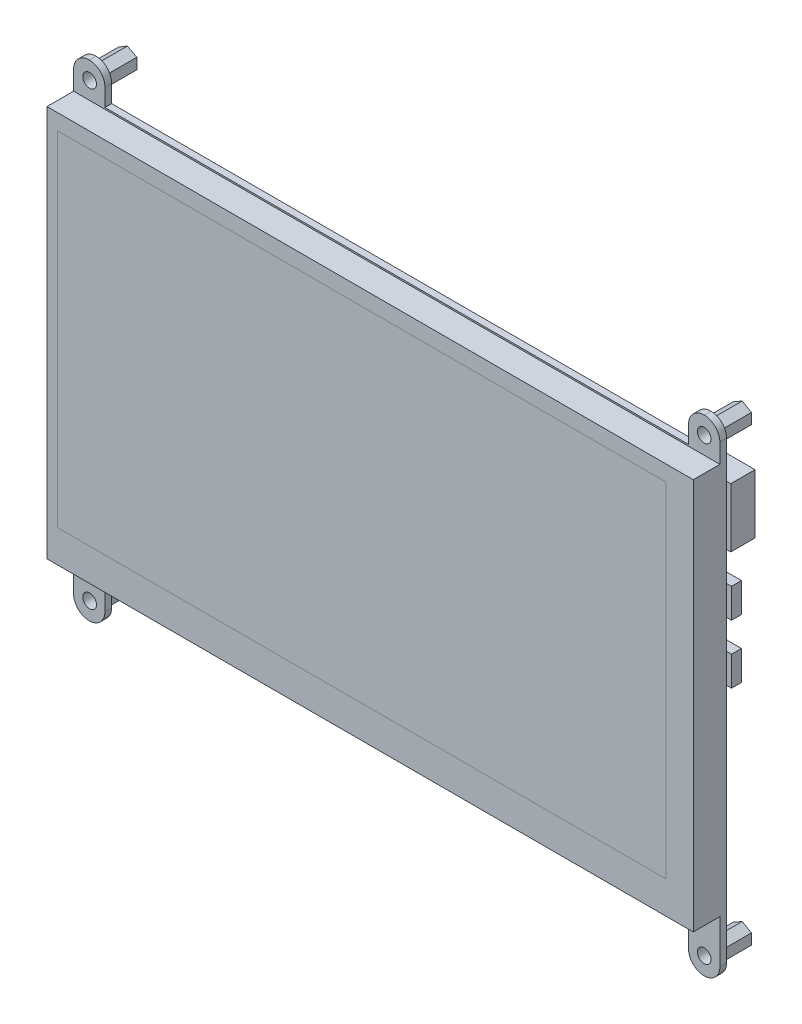
from build123d import *

# Parameters (mm, degrees)
ESQUISSE1_R        = 1.75
BOSS_EXTRU_1_DEPTH = 1.72
CONG_1_R           = 4
ESQUISSE2_W        = 165
ESQUISSE2_H        = 100
BOSS_EXTRU_2_DEPTH = 6.79
ESQUISSE3_W        = 12.17
ESQUISSE3_H        = 15.1
BOSS_EXTRU_3_DEPTH = 6.19
ESQUISSE4_W        = 5.85
ESQUISSE4_H        = 7.52
BOSS_EXTRU_4_DEPTH = 2.55
BOSS_EXTRU_5_START = 8
ESQUISSE5_R        = 1.75
BOSS_EXTRU_5_DEPTH = 8


with BuildPart() as part:
    # Esquisse1 → Boss.-Extru.1 (new body)
    with BuildSketch(Plane.XY):
        Polygon((-74.5, 53.5), (74.5, 53.5), (74.5, 62), (82.5, 62), (82.5, -62), (74.5, -62), (74.5, -53.5), (-74.5, -53.5), (-74.5, -62), (-82.5, -62), (-82.5, 62), (-74.5, 62), align=None)
        with Locations((78.5, 57.54)):
            Circle(ESQUISSE1_R, mode=Mode.SUBTRACT)
        with Locations((-78.4, 57.54)):
            Circle(ESQUISSE1_R, mode=Mode.SUBTRACT)
        with Locations((-78.4, -57.54)):
            Circle(ESQUISSE1_R, mode=Mode.SUBTRACT)
        with Locations((78.5, -57.54)):
            Circle(ESQUISSE1_R, mode=Mode.SUBTRACT)
    extrude(amount=BOSS_EXTRU_1_DEPTH)

    # Congé1
    cong_1_edges = [part.edges().sort_by_distance(p)[0] for p in [
        (74.5, -62, 0.86),
        (82.5, -62, 0.86),
        (82.5, 62, 0.86),
        (74.5, 62, 0.86),
        (-74.5, 62, 0.86),
        (-82.5, 62, 0.86),
        (-82.5, -62, 0.86),
        (-74.5, -62, 0.86),
    ]]
    fillet(cong_1_edges, radius=CONG_1_R - 0.0001)  # a hair under: the kernel refuses the full size

    # Esquisse2 → Boss.-Extru.2 (add)
    with BuildSketch(Plane.XY.offset(1.72)):
        with Locations((0, 3.1)):
            Rectangle(ESQUISSE2_W, ESQUISSE2_H)
    extrude(amount=BOSS_EXTRU_2_DEPTH)

    # Esquisse3 → Boss.-Extru.3 (add)
    with BuildSketch(Plane(origin=(0, 0, 0), x_dir=(-1, 0, 0), z_dir=(0, 0, -1))):
        with Locations((-77.485, 40.95)):
            Rectangle(ESQUISSE3_W, ESQUISSE3_H)
    extrude(amount=BOSS_EXTRU_3_DEPTH)

    # Esquisse4 → Boss.-Extru.4 (add)
    with BuildSketch(Plane(origin=(0, 0, 0), x_dir=(-1, 0, 0), z_dir=(0, 0, -1))):
        with Locations((-80.825, 22.14)):
            Rectangle(ESQUISSE4_W, ESQUISSE4_H)
        with Locations((-80.825, 7.12)):
            Rectangle(ESQUISSE4_W, ESQUISSE4_H)
    extrude(amount=BOSS_EXTRU_4_DEPTH)

    # Esquisse5 → Boss.-Extru.5 (add)
    # profile 1 of 4: a face of its own
    with BuildSketch(Plane(origin=(0, 0, 0), x_dir=(-1, 0, 0), z_dir=(0, 0, -1)).offset(BOSS_EXTRU_5_START)):
        Polygon((-78.5, -54.826453735), (-80.85, -56.183226867), (-80.85, -58.896773133), (-78.5, -60.253546265), (-76.15, -58.896773133), (-76.15, -56.183226867), align=None)
        with Locations((-78.5, -57.54)):
            Circle(ESQUISSE5_R, mode=Mode.SUBTRACT)
    # profile 2 of 4: a face of its own
    with BuildSketch(Plane(origin=(0, 0, 0), x_dir=(-1, 0, 0), z_dir=(0, 0, -1)).offset(BOSS_EXTRU_5_START)):
        Polygon((-78.5, 60.253546265), (-80.85, 58.896773133), (-80.85, 56.183226867), (-78.5, 54.826453735), (-76.15, 56.183226867), (-76.15, 58.896773133), align=None)
        with Locations((-78.5, 57.54)):
            Circle(ESQUISSE5_R, mode=Mode.SUBTRACT)
    # profile 3 of 4: a face of its own
    with BuildSketch(Plane(origin=(0, 0, 0), x_dir=(-1, 0, 0), z_dir=(0, 0, -1)).offset(BOSS_EXTRU_5_START)):
        Polygon((78.460826557, 60.252864439), (76.081003757, 58.949109563), (76.020177201, 56.236245124), (78.339173443, 54.827135561), (80.718996243, 56.130890437), (80.779822799, 58.843754876), align=None)
        with Locations((78.4, 57.54)):
            Circle(ESQUISSE5_R, mode=Mode.SUBTRACT)
    # profile 4 of 4: a face of its own
    with BuildSketch(Plane(origin=(0, 0, 0), x_dir=(-1, 0, 0), z_dir=(0, 0, -1)).offset(BOSS_EXTRU_5_START)):
        Polygon((78.4, -54.826453735), (76.05, -56.183226867), (76.05, -58.896773133), (78.4, -60.253546265), (80.75, -58.896773133), (80.75, -56.183226867), align=None)
        with Locations((78.4, -57.54)):
            Circle(ESQUISSE5_R, mode=Mode.SUBTRACT)
    extrude(amount=-BOSS_EXTRU_5_DEPTH)


solid = part.part
